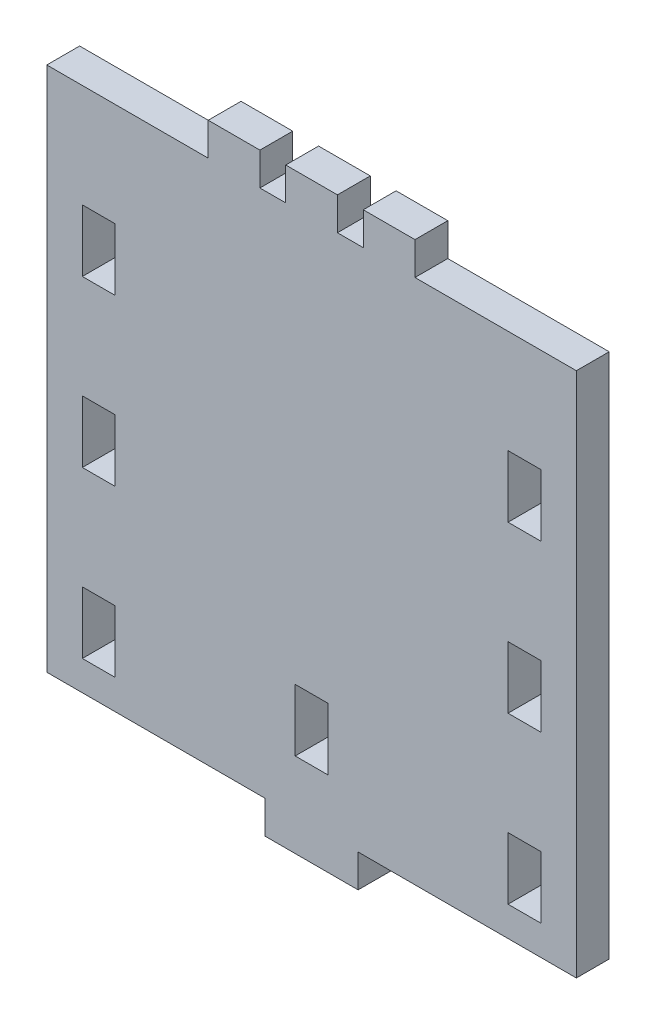
from build123d import *

# Parameters (mm, degrees)
SKETCH1_W           = 3.175
SKETCH1_H           = 6
BOSS_EXTRUDE1_DEPTH = 1.5875


with BuildPart() as part:
    # Sketch1 → Boss-Extrude1 (new, symmetric)
    with BuildSketch(Plane.XY):
        Polygon((0, 0), (-21.1125, 0), (-21.1125, -3.175), (-30.1125, -3.175), (-30.1125, 0), (-51.225, 0), (-51.225, 50.875), (-35.6125, 50.875), (-35.6125, 54.05), (-30.6125, 54.05), (-30.6125, 50.875), (-28.1125, 50.875), (-28.1125, 54.05), (-23.1125, 54.05), (-23.1125, 50.875), (-20.6125, 50.875), (-20.6125, 54.05), (-15.6125, 54.05), (-15.6125, 50.875), (0, 50.875), align=None)
        with Locations((-5.025, 5.875)):
            Rectangle(SKETCH1_W, SKETCH1_H, mode=Mode.SUBTRACT)
        Polygon((-5.025, 18.875), (-3.4375, 18.875), (-3.4375, 24.875), (-6.6125, 24.875), (-6.6125, 18.875), align=None, mode=Mode.SUBTRACT)
        Polygon((-5.025, 34.875), (-3.4375, 34.875), (-3.4375, 40.875), (-6.6125, 40.875), (-6.6125, 34.875), align=None, mode=Mode.SUBTRACT)
        Polygon((-44.6125, 34.875), (-46.2, 34.875), (-47.7875, 34.875), (-47.7875, 40.875), (-44.6125, 40.875), align=None, mode=Mode.SUBTRACT)
        Polygon((-44.6125, 18.875), (-46.2, 18.875), (-47.7875, 18.875), (-47.7875, 24.875), (-44.6125, 24.875), align=None, mode=Mode.SUBTRACT)
        with Locations((-46.2, 5.875)):
            Rectangle(SKETCH1_W, SKETCH1_H, mode=Mode.SUBTRACT)
        Polygon((-24.025, 5), (-25.6125, 5), (-27.2, 5), (-27.2, 11), (-24.025, 11), align=None, mode=Mode.SUBTRACT)
    extrude(amount=BOSS_EXTRUDE1_DEPTH, both=True)


solid = part.part
